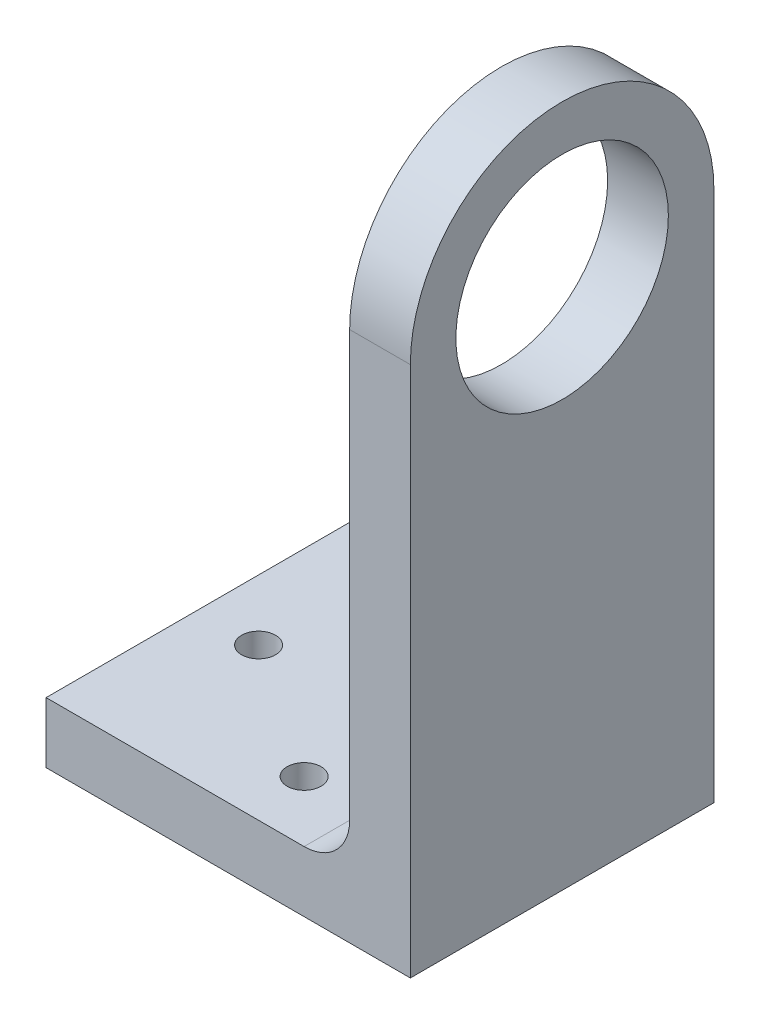
from build123d import *

# Parameters (mm, degrees)
SKETCH3_R           = 11.1125
BOSS_EXTRUDE1_DEPTH = 6.35
SKETCH5_W           = 31.75
SKETCH5_H           = 6.35
BOSS_EXTRUDE2_DEPTH = 38.1
FILLET1_R           = 4.7625
SKETCH6_R           = 1.777000002
CUT_EXTRUDE1_DEPTH  = 80.072799724


with BuildPart() as part:
    # Sketch3 → Boss-Extrude1 (new body)
    with BuildSketch(Plane(origin=(0, 0, 0), x_dir=(0, 0, -1), z_dir=(1, 0, 0))):
        with BuildLine():
            Line((0, 0), (31.75, 0))
            Line((31.75, 0), (31.75, 49.2125))
            ThreePointArc((31.75, 49.2125), (15.875, 65.0875), (0, 49.2125))
            Line((0, 49.2125), (0, 0))
        make_face()
        with Locations((15.875, 49.2125)):
            Circle(SKETCH3_R, mode=Mode.SUBTRACT)
    extrude(amount=BOSS_EXTRUDE1_DEPTH)

    # Sketch5 → Boss-Extrude2 (add)
    with BuildSketch(Plane(origin=(6.35, 0, 0), x_dir=(0, 0, -1), z_dir=(1, 0, 0))):
        with Locations((15.875, -3.175)):
            Rectangle(SKETCH5_W, SKETCH5_H)
    extrude(amount=-BOSS_EXTRUDE2_DEPTH)

    # Fillet1
    fillet1_edges = [part.edges().sort_by_distance(p)[0] for p in [
        (0, 0, -15.875),
    ]]
    fillet(fillet1_edges, radius=FILLET1_R)

    # Sketch6 → Cut-Extrude1 (cut, through all)
    with BuildSketch(Plane(origin=(0, 0, 0), x_dir=(1, 0, 0), z_dir=(0, 1, 0))):
        with Locations((-11.1125, 6.35)):
            Circle(SKETCH6_R)
        with Locations((-25.4, 15.875)):
            Circle(SKETCH6_R)
        with Locations((-11.1125, 25.4)):
            Circle(SKETCH6_R)
    extrude(amount=-CUT_EXTRUDE1_DEPTH, mode=Mode.SUBTRACT)


solid = part.part
